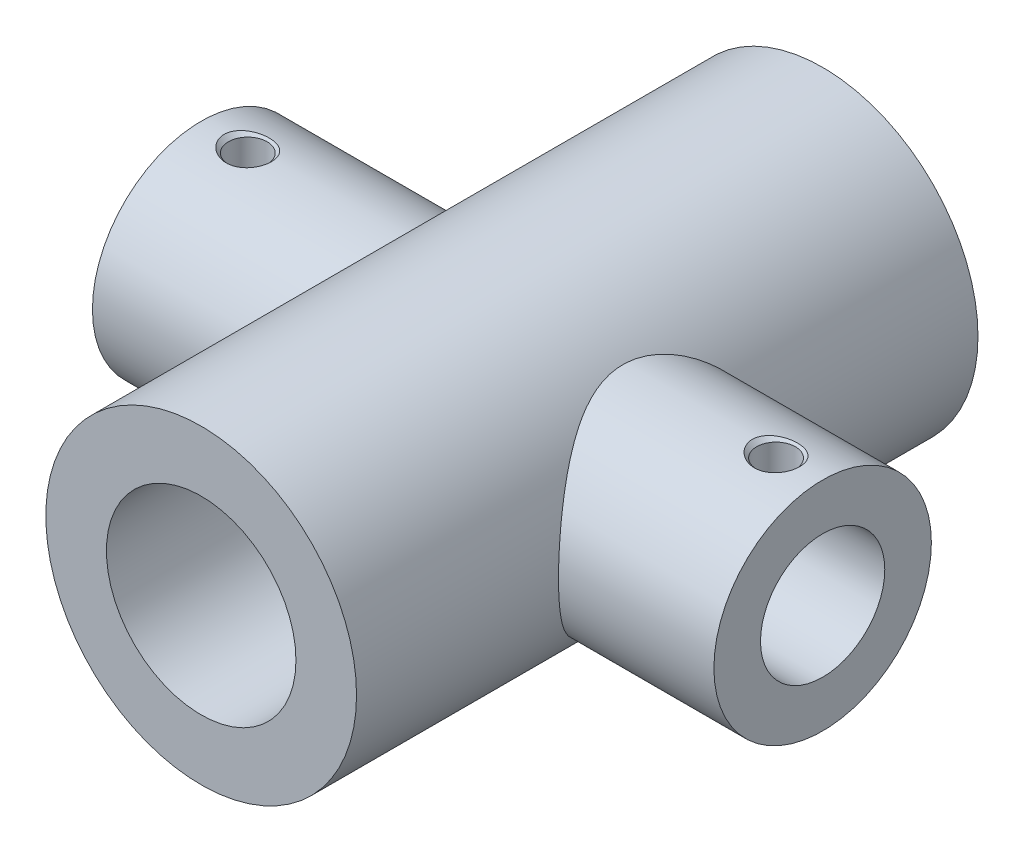
from build123d import *

# Parameters (mm, degrees)
SKETCH1_R               = 10
SKETCH1_R_2             = 6.1
BOSS_EXTRUDE1_DEPTH     = 20
SKETCH2_R               = 7
SKETCH2_R_2             = 4
BOSS_EXTRUDE2_DEPTH     = 20
CUT_EXTRUDE1_DEPTH      = 31.000000167
CUT_EXTRUDE1_DEPTH_BACK = 31.000000167
SKETCH5_R               = 6.1


# Read off the part's stored shape, not the designer's step: M3 Tapped Hole1
with BuildPart() as part:
    # Sketch1 → Boss-Extrude1 (new, symmetric)
    with BuildSketch(Plane.XY):
        Circle(SKETCH1_R)
        Circle(SKETCH1_R_2, mode=Mode.SUBTRACT)
    extrude(amount=BOSS_EXTRUDE1_DEPTH, both=True)

    # Sketch2 → Boss-Extrude2 (add, symmetric)
    with BuildSketch(Plane(origin=(0, 0, 0), x_dir=(0, 0, -1), z_dir=(1, 0, 0))):
        Circle(SKETCH2_R)
        with Locations(Location((0, 0, 0), (0, 0, 180))):
            Circle(SKETCH2_R_2, mode=Mode.SUBTRACT)
    extrude(amount=BOSS_EXTRUDE2_DEPTH, both=True)

    # M3 Tapped Hole1 outline → M3 Tapped Hole1 (revolve, cut)
    with BuildSketch(Plane(origin=(17, 0, 0), x_dir=(1, 0, 0), z_dir=(0, 0, 1))):
        Polygon((1.525056823, 7.000056823), (0, 7.000056823), (0, 3.799585789), (1.25, 3.799585789), (1.25, 6.725), align=None)
    revolve(axis=Axis((17, 0, 0), (0, 1, 0)), mode=Mode.SUBTRACT)

    # M3 Tapped Hole1 2 outline → M3 Tapped Hole1 2 (revolve, cut)
    with BuildSketch(Plane(origin=(-17, 0, 0), x_dir=(1, 0, 0), z_dir=(0, 0, 1))):
        Polygon((1.525056823, 7.000056823), (0, 7.000056823), (0, 3.799585789), (1.25, 3.799585789), (1.25, 6.725), align=None)
    revolve(axis=Axis((-17, 0, 0), (0, 1, 0)), mode=Mode.SUBTRACT)

    # Sketch5 → Cut-Extrude1 (cut, two sides: drawn at the far end of the back side and taken through both)
    with BuildSketch(Plane.XY.offset(-CUT_EXTRUDE1_DEPTH_BACK)):
        Circle(SKETCH5_R)
    extrude(amount=CUT_EXTRUDE1_DEPTH + CUT_EXTRUDE1_DEPTH_BACK, mode=Mode.SUBTRACT)


solid = part.part
